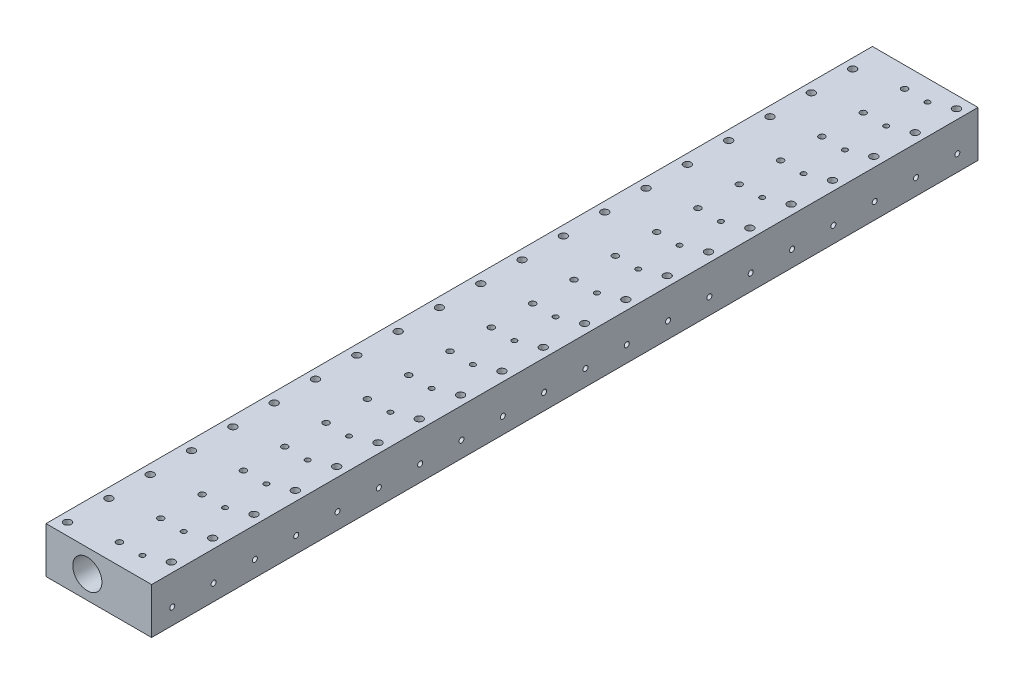
from build123d import *

# Parameters (mm, degrees)
SKETCH1_W                      = 23
SKETCH1_H                      = 10
BOSS_EXTRUDE1_DEPTH            = 180
SKETCH5_R                      = 3.175
CUT_EXTRUDE1_DEPTH             = 181.43627684
M2X0_4_TAPPED_HOLE1_AT_2_COUNT = 2
M2X0_4_TAPPED_HOLE1_AT_2_PITCH = 19.180198122
LPATTERN1_COUNT                = 20
LPATTERN1_PITCH                = 9


with BuildPart() as part:
    # Sketch1 → Boss-Extrude1 (new body)
    with BuildSketch(Plane.XY):
        Rectangle(SKETCH1_W, SKETCH1_H)
    extrude(amount=-BOSS_EXTRUDE1_DEPTH)

    # Sketch4 → #55 (0.052) Diameter Hole1 (revolve, cut)
    with BuildSketch(Plane(origin=(0, 5, -4.5), x_dir=(0, 0, 1), z_dir=(1, 0, 0))):
        Polygon((0, 0), (0, 7.396808353), (0.6604, 7), (0.6604, 0), align=None)
    f_55_0_052_diameter_hole1 = revolve(axis=Axis((0, 11.35, -4.5), (0, -1, 0)), mode=Mode.SUBTRACT)

    # Sketch5 → Cut-Extrude1 (cut, through all)
    with BuildSketch(Plane.XY):
        with Locations((-2.5, 0)):
            Circle(SKETCH5_R)
    extrude(amount=-CUT_EXTRUDE1_DEPTH, mode=Mode.SUBTRACT)

    # Sketch8 → M2x0.4 Tapped Hole1 (revolve, cut)
    with BuildSketch(Plane(origin=(9.4, 5, -6.4), x_dir=(0, 0, 1), z_dir=(1, 0, 0))):
        Polygon((0, 0), (0, 5.680688495), (0.8, 5.2), (0.8, 0), align=None)
    m2x0_4_tapped_hole1 = revolve(axis=Axis((9.4, 11.35, -6.4), (0, -1, 0)), mode=Mode.SUBTRACT)

    # M2x0.4 Tapped Hole1 at 2: M2x0.4 Tapped Hole1 ×2
    with Locations(*[Vector(-0.9801775706589259, 0, 0.1981209983246765) * (i * M2X0_4_TAPPED_HOLE1_AT_2_PITCH) for i in range(1, M2X0_4_TAPPED_HOLE1_AT_2_COUNT)]):
        add(m2x0_4_tapped_hole1, mode=Mode.SUBTRACT)

    # Sketch12 → #57 (0.043) Diameter Hole1 (revolve, cut)
    with BuildSketch(Plane(origin=(11.5, -1.5, -4.5), x_dir=(0, 0, -1), z_dir=(0, 1, 0))):
        Polygon((0, 0), (0, 6.328129984), (0.5461, 6), (0.5461, 0), align=None)
    f_57_0_043_diameter_hole1 = revolve(axis=Axis((17.85, -1.5, -4.5), (-1, 0, 0)), mode=Mode.SUBTRACT)

    # Sketch14 → #57 (0.043) Diameter Hole2 (revolve, cut)
    with BuildSketch(Plane(origin=(5, 5, -4.5), x_dir=(0, 0, 1), z_dir=(1, 0, 0))):
        Polygon((0, 0), (0, 7.828129984), (0.5461, 7.5), (0.5461, 0), align=None)
    f_57_0_043_diameter_hole2 = revolve(axis=Axis((5, 11.35, -4.5), (0, -1, 0)), mode=Mode.SUBTRACT)

    # LPattern1: #55 (0.052) Diameter Hole1, M2x0.4 Tapped Hole1, #57 (0.043) Diameter Hole1, #57 (0.043) Diameter Hole2 ×20
    with Locations(*[(0, 0, -i * LPATTERN1_PITCH) for i in range(1, LPATTERN1_COUNT)]):
        add(f_55_0_052_diameter_hole1, mode=Mode.SUBTRACT)
        add(m2x0_4_tapped_hole1, mode=Mode.SUBTRACT)
        add(f_57_0_043_diameter_hole1, mode=Mode.SUBTRACT)
        add(f_57_0_043_diameter_hole2, mode=Mode.SUBTRACT)

    # LPattern1 copy 1 sketch → LPattern1 copy 1 (revolve, cut)
    with BuildSketch(Plane(origin=(-9.4, 5, -11.6), x_dir=(0, 0, 1), z_dir=(1, 0, 0))):
        Polygon((0, 0), (0, 5.680688495), (0.8, 5.2), (0.8, 0), align=None)
    revolve(axis=Axis((-9.4, 11.35, -11.6), (0, -1, 0)), mode=Mode.SUBTRACT)

    # LPattern1 copy 2 sketch → LPattern1 copy 2 (revolve, cut)
    with BuildSketch(Plane(origin=(-9.4, 5, -20.6), x_dir=(0, 0, 1), z_dir=(1, 0, 0))):
        Polygon((0, 0), (0, 5.680688495), (0.8, 5.2), (0.8, 0), align=None)
    revolve(axis=Axis((-9.4, 11.35, -20.6), (0, -1, 0)), mode=Mode.SUBTRACT)

    # LPattern1 copy 3 sketch → LPattern1 copy 3 (revolve, cut)
    with BuildSketch(Plane(origin=(-9.4, 5, -29.6), x_dir=(0, 0, 1), z_dir=(1, 0, 0))):
        Polygon((0, 0), (0, 5.680688495), (0.8, 5.2), (0.8, 0), align=None)
    revolve(axis=Axis((-9.4, 11.35, -29.6), (0, -1, 0)), mode=Mode.SUBTRACT)

    # LPattern1 copy 4 sketch → LPattern1 copy 4 (revolve, cut)
    with BuildSketch(Plane(origin=(-9.4, 5, -38.6), x_dir=(0, 0, 1), z_dir=(1, 0, 0))):
        Polygon((0, 0), (0, 5.680688495), (0.8, 5.2), (0.8, 0), align=None)
    revolve(axis=Axis((-9.4, 11.35, -38.6), (0, -1, 0)), mode=Mode.SUBTRACT)

    # LPattern1 copy 5 sketch → LPattern1 copy 5 (revolve, cut)
    with BuildSketch(Plane(origin=(-9.4, 5, -47.6), x_dir=(0, 0, 1), z_dir=(1, 0, 0))):
        Polygon((0, 0), (0, 5.680688495), (0.8, 5.2), (0.8, 0), align=None)
    revolve(axis=Axis((-9.4, 11.35, -47.6), (0, -1, 0)), mode=Mode.SUBTRACT)

    # LPattern1 copy 6 sketch → LPattern1 copy 6 (revolve, cut)
    with BuildSketch(Plane(origin=(-9.4, 5, -56.6), x_dir=(0, 0, 1), z_dir=(1, 0, 0))):
        Polygon((0, 0), (0, 5.680688495), (0.8, 5.2), (0.8, 0), align=None)
    revolve(axis=Axis((-9.4, 11.35, -56.6), (0, -1, 0)), mode=Mode.SUBTRACT)

    # LPattern1 copy 7 sketch → LPattern1 copy 7 (revolve, cut)
    with BuildSketch(Plane(origin=(-9.4, 5, -65.6), x_dir=(0, 0, 1), z_dir=(1, 0, 0))):
        Polygon((0, 0), (0, 5.680688495), (0.8, 5.2), (0.8, 0), align=None)
    revolve(axis=Axis((-9.4, 11.35, -65.6), (0, -1, 0)), mode=Mode.SUBTRACT)

    # LPattern1 copy 8 sketch → LPattern1 copy 8 (revolve, cut)
    with BuildSketch(Plane(origin=(-9.4, 5, -74.6), x_dir=(0, 0, 1), z_dir=(1, 0, 0))):
        Polygon((0, 0), (0, 5.680688495), (0.8, 5.2), (0.8, 0), align=None)
    revolve(axis=Axis((-9.4, 11.35, -74.6), (0, -1, 0)), mode=Mode.SUBTRACT)

    # LPattern1 copy 9 sketch → LPattern1 copy 9 (revolve, cut)
    with BuildSketch(Plane(origin=(-9.4, 5, -83.6), x_dir=(0, 0, 1), z_dir=(1, 0, 0))):
        Polygon((0, 0), (0, 5.680688495), (0.8, 5.2), (0.8, 0), align=None)
    revolve(axis=Axis((-9.4, 11.35, -83.6), (0, -1, 0)), mode=Mode.SUBTRACT)

    # LPattern1 copy 10 sketch → LPattern1 copy 10 (revolve, cut)
    with BuildSketch(Plane(origin=(-9.4, 5, -92.6), x_dir=(0, 0, 1), z_dir=(1, 0, 0))):
        Polygon((0, 0), (0, 5.680688495), (0.8, 5.2), (0.8, 0), align=None)
    revolve(axis=Axis((-9.4, 11.35, -92.6), (0, -1, 0)), mode=Mode.SUBTRACT)

    # LPattern1 copy 11 sketch → LPattern1 copy 11 (revolve, cut)
    with BuildSketch(Plane(origin=(-9.4, 5, -101.6), x_dir=(0, 0, 1), z_dir=(1, 0, 0))):
        Polygon((0, 0), (0, 5.680688495), (0.8, 5.2), (0.8, 0), align=None)
    revolve(axis=Axis((-9.4, 11.35, -101.6), (0, -1, 0)), mode=Mode.SUBTRACT)

    # LPattern1 copy 12 sketch → LPattern1 copy 12 (revolve, cut)
    with BuildSketch(Plane(origin=(-9.4, 5, -110.6), x_dir=(0, 0, 1), z_dir=(1, 0, 0))):
        Polygon((0, 0), (0, 5.680688495), (0.8, 5.2), (0.8, 0), align=None)
    revolve(axis=Axis((-9.4, 11.35, -110.6), (0, -1, 0)), mode=Mode.SUBTRACT)

    # LPattern1 copy 13 sketch → LPattern1 copy 13 (revolve, cut)
    with BuildSketch(Plane(origin=(-9.4, 5, -119.6), x_dir=(0, 0, 1), z_dir=(1, 0, 0))):
        Polygon((0, 0), (0, 5.680688495), (0.8, 5.2), (0.8, 0), align=None)
    revolve(axis=Axis((-9.4, 11.35, -119.6), (0, -1, 0)), mode=Mode.SUBTRACT)

    # LPattern1 copy 14 sketch → LPattern1 copy 14 (revolve, cut)
    with BuildSketch(Plane(origin=(-9.4, 5, -128.6), x_dir=(0, 0, 1), z_dir=(1, 0, 0))):
        Polygon((0, 0), (0, 5.680688495), (0.8, 5.2), (0.8, 0), align=None)
    revolve(axis=Axis((-9.4, 11.35, -128.6), (0, -1, 0)), mode=Mode.SUBTRACT)

    # LPattern1 copy 15 sketch → LPattern1 copy 15 (revolve, cut)
    with BuildSketch(Plane(origin=(-9.4, 5, -137.6), x_dir=(0, 0, 1), z_dir=(1, 0, 0))):
        Polygon((0, 0), (0, 5.680688495), (0.8, 5.2), (0.8, 0), align=None)
    revolve(axis=Axis((-9.4, 11.35, -137.6), (0, -1, 0)), mode=Mode.SUBTRACT)

    # LPattern1 copy 16 sketch → LPattern1 copy 16 (revolve, cut)
    with BuildSketch(Plane(origin=(-9.4, 5, -146.6), x_dir=(0, 0, 1), z_dir=(1, 0, 0))):
        Polygon((0, 0), (0, 5.680688495), (0.8, 5.2), (0.8, 0), align=None)
    revolve(axis=Axis((-9.4, 11.35, -146.6), (0, -1, 0)), mode=Mode.SUBTRACT)

    # LPattern1 copy 17 sketch → LPattern1 copy 17 (revolve, cut)
    with BuildSketch(Plane(origin=(-9.4, 5, -155.6), x_dir=(0, 0, 1), z_dir=(1, 0, 0))):
        Polygon((0, 0), (0, 5.680688495), (0.8, 5.2), (0.8, 0), align=None)
    revolve(axis=Axis((-9.4, 11.35, -155.6), (0, -1, 0)), mode=Mode.SUBTRACT)

    # LPattern1 copy 18 sketch → LPattern1 copy 18 (revolve, cut)
    with BuildSketch(Plane(origin=(-9.4, 5, -164.6), x_dir=(0, 0, 1), z_dir=(1, 0, 0))):
        Polygon((0, 0), (0, 5.680688495), (0.8, 5.2), (0.8, 0), align=None)
    revolve(axis=Axis((-9.4, 11.35, -164.6), (0, -1, 0)), mode=Mode.SUBTRACT)

    # LPattern1 copy 19 sketch → LPattern1 copy 19 (revolve, cut)
    with BuildSketch(Plane(origin=(-9.4, 5, -173.6), x_dir=(0, 0, 1), z_dir=(1, 0, 0))):
        Polygon((0, 0), (0, 5.680688495), (0.8, 5.2), (0.8, 0), align=None)
    revolve(axis=Axis((-9.4, 11.35, -173.6), (0, -1, 0)), mode=Mode.SUBTRACT)


solid = part.part
